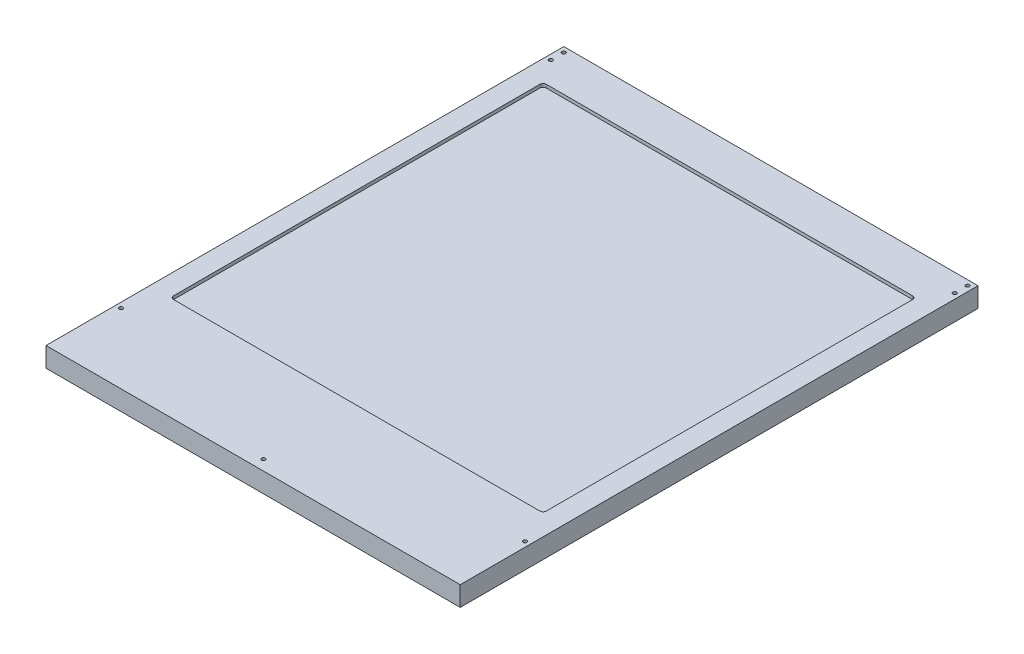
from build123d import *

# Parameters (mm, degrees)
SKETCH2_W            = 400
SKETCH2_H            = 500
BOSS_EXTRUDE1_DEPTH  = 19.05
SKETCH3_W            = 360
SKETCH3_H            = 360
CUT_EXTRUDE1_DEPTH   = 3.175
FILLET1_R            = 3.175
M3_CLEARANCE_HOLE1_D = 3.6
M3_CLEARANCE_HOLE2_D = 3.6


with BuildPart() as part:
    # Sketch2 → Boss-Extrude1 (new body)
    with BuildSketch(Plane(origin=(0, 0, 0), x_dir=(1, 0, 0), z_dir=(0, 1, 0))):
        with Locations((200, 250)):
            Rectangle(SKETCH2_W, SKETCH2_H)
    extrude(amount=BOSS_EXTRUDE1_DEPTH)

    # Sketch3 → Cut-Extrude1 (cut)
    with BuildSketch(Plane(origin=(0, 19.05, 0), x_dir=(1, 0, 0), z_dir=(0, 1, 0))):
        with Locations((200, 280)):
            Rectangle(SKETCH3_W, SKETCH3_H)
    extrude(amount=-CUT_EXTRUDE1_DEPTH, mode=Mode.SUBTRACT)

    # Fillet1
    fillet1_edges = [part.edges().sort_by_distance(p)[0] for p in [
        (20, 17.4625, -100),
        (380, 17.4625, -100),
        (380, 17.4625, -460),
        (20, 17.4625, -460),
    ]]
    fillet(fillet1_edges, radius=FILLET1_R)

    # M3 Clearance Hole1 (through all)
    with Locations(Plane(origin=(395, 19.05, -495), x_dir=(0, 0, 1), z_dir=(0, 1, 0))):
        with Locations((0, 0), (0, -390), (485, -195)):
            Hole(M3_CLEARANCE_HOLE1_D / 2)

    # M3 Clearance Hole2 (through all)
    with Locations(Plane(origin=(395, 19.05, -482.5), x_dir=(0, 0, 1), z_dir=(0, 1, 0))):
        with Locations((0, 0), (0, -390), (415, -390), (415, 0)):
            Hole(M3_CLEARANCE_HOLE2_D / 2)


solid = part.part
